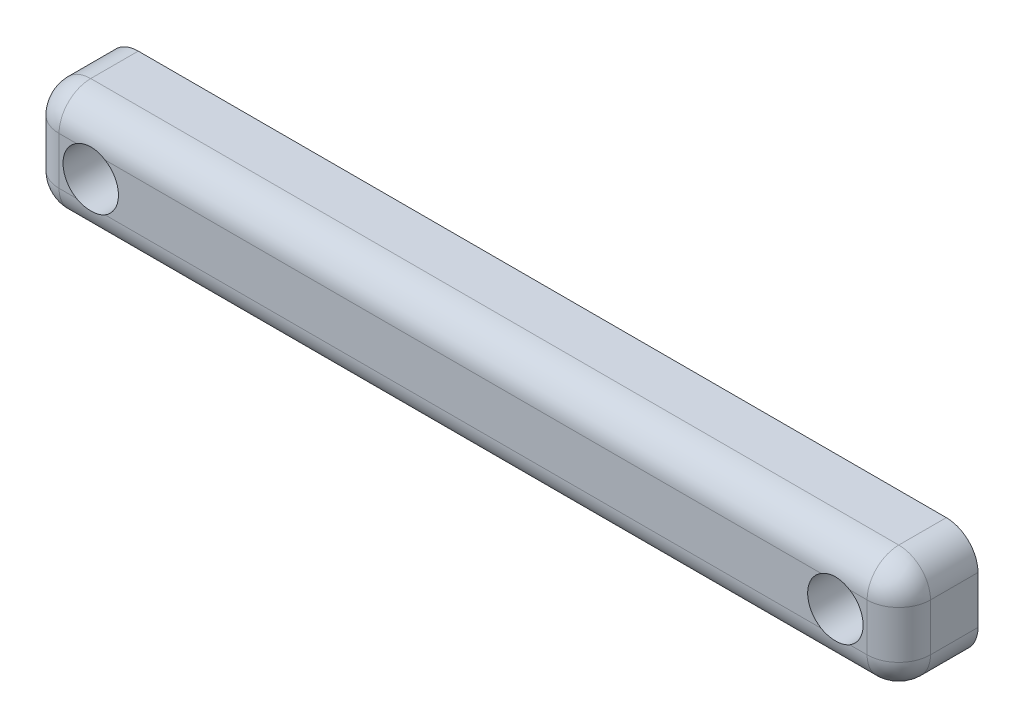
from build123d import *

# Parameters (mm, degrees)
SKETCH1_R           = 1.75
BOSS_EXTRUDE1_DEPTH = 5
FILLET1_R           = 2


with BuildPart() as part:
    # Sketch1 → Boss-Extrude1 (new body)
    with BuildSketch(Plane.XY):
        with BuildLine():
            Line((-25.5, 3.5), (25.5, 3.5))
            ThreePointArc((25.5, 3.5), (26.914213562, 2.914213562), (27.5, 1.5))
            Line((27.5, 1.5), (27.5, -1.5))
            ThreePointArc((27.5, -1.5), (26.914213562, -2.914213562), (25.5, -3.5))
            Line((25.5, -3.5), (-25.5, -3.5))
            ThreePointArc((-25.5, -3.5), (-26.914213562, -2.914213562), (-27.5, -1.5))
            Line((-27.5, -1.5), (-27.5, 1.5))
            ThreePointArc((-27.5, 1.5), (-26.914213562, 2.914213562), (-25.5, 3.5))
        make_face()
        with Locations((-23.5, 0)):
            Circle(SKETCH1_R, mode=Mode.SUBTRACT)
        with Locations((23.5, 0)):
            Circle(SKETCH1_R, mode=Mode.SUBTRACT)
    extrude(amount=BOSS_EXTRUDE1_DEPTH)

    # Fillet1
    # the kernel refuses this fillet: 2 mm, written as the material it takes off along each edge
    with BuildSketch(Plane(origin=(-25.5, 1.5, 5), x_dir=(-1, 0, 0), z_dir=(0, -1, 0))) as fillet1_piece_1:
        with BuildLine():
            CenterArc((2 - FILLET1_R, FILLET1_R), FILLET1_R, 270, 90)
            Line((2 - FILLET1_R, 0), (2, 0))
            Line((2, 0), (2, FILLET1_R))
        make_face()
    revolve(axis=Axis((-25.5, 1.5, 5), (0, 0, -1)), revolution_arc=90, mode=Mode.SUBTRACT)
    with BuildSketch(Plane(origin=(-27.5, -1.5, 5), x_dir=(0, 0, -1), z_dir=(0, 1, 0)), Plane(origin=(27.5, 1.5, 5), x_dir=(0, 0, -1), z_dir=(0, -1, 0))) as fillet1_piece_2:
        with BuildLine():
            CenterArc((FILLET1_R, -FILLET1_R), FILLET1_R, 90, 90)
            Line((0, -FILLET1_R), (0, 0))
            Line((0, 0), (FILLET1_R, 0))
        make_face()
    extrude(amount=3, mode=Mode.SUBTRACT)
    with BuildSketch(Plane(origin=(-25.5, -1.5, 5), x_dir=(0, -1, 0), z_dir=(1, 0, 0))) as fillet1_piece_3:
        with BuildLine():
            CenterArc((2 - FILLET1_R, FILLET1_R), FILLET1_R, 270, 90)
            Line((2 - FILLET1_R, 0), (2, 0))
            Line((2, 0), (2, FILLET1_R))
        make_face()
    revolve(axis=Axis((-25.5, -1.5, 5), (0, 0, -1)), revolution_arc=90, mode=Mode.SUBTRACT)
    with BuildSketch(Plane(origin=(25.5, -3.5, 5), x_dir=(0, 0, -1), z_dir=(-1, 0, 0)), Plane(origin=(-25.5, 3.5, 5), x_dir=(0, 0, -1), z_dir=(1, 0, 0))) as fillet1_piece_4:
        with BuildLine():
            CenterArc((FILLET1_R, -FILLET1_R), FILLET1_R, 90, 90)
            Line((0, -FILLET1_R), (0, 0))
            Line((0, 0), (FILLET1_R, 0))
        make_face()
    extrude(amount=51, mode=Mode.SUBTRACT)
    with BuildSketch(Plane(origin=(25.5, -1.5, 5), x_dir=(1, 0, 0), z_dir=(0, 1, 0))) as fillet1_piece_5:
        with BuildLine():
            CenterArc((2 - FILLET1_R, FILLET1_R), FILLET1_R, 270, 90)
            Line((2 - FILLET1_R, 0), (2, 0))
            Line((2, 0), (2, FILLET1_R))
        make_face()
    revolve(axis=Axis((25.5, -1.5, 5), (0, 0, -1)), revolution_arc=90, mode=Mode.SUBTRACT)
    with BuildSketch(Plane(origin=(25.5, 1.5, 5), x_dir=(0, 1, 0), z_dir=(-1, 0, 0))) as fillet1_piece_6:
        with BuildLine():
            CenterArc((2 - FILLET1_R, FILLET1_R), FILLET1_R, 270, 90)
            Line((2 - FILLET1_R, 0), (2, 0))
            Line((2, 0), (2, FILLET1_R))
        make_face()
    revolve(axis=Axis((25.5, 1.5, 5), (0, 0, -1)), revolution_arc=90, mode=Mode.SUBTRACT)


solid = part.part
